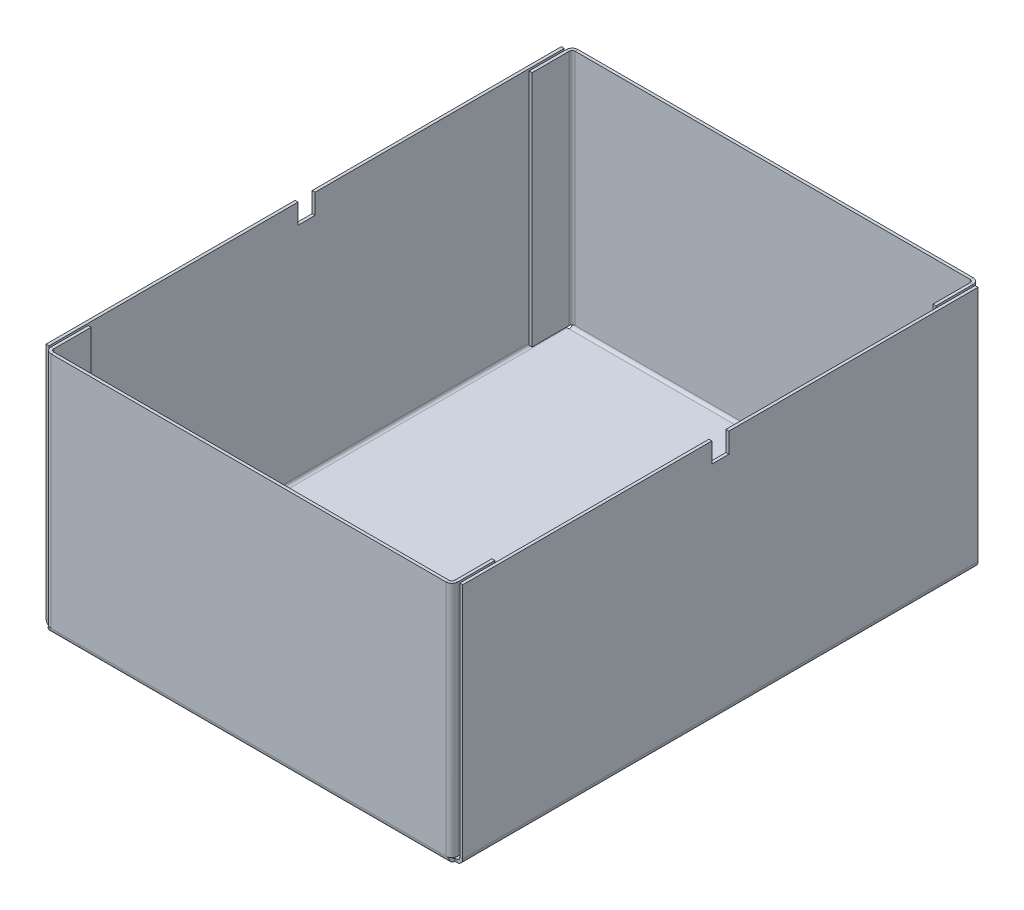
from build123d import *

# Parameters (mm, degrees)
SKETCH1_W                        = 100
SKETCH1_H                        = 130
BASE_FLANGE1_DEPTH               = 0.7366
BOX_REAR_STRIP_W                 = 4.4196
BOX_REAR_STRIP_H                 = 0.7366
BOX_REAR_STRIP_CUT_DEPTH         = 100
BOX_REAR_DEPTH                   = 100
BOX_FRONT_STRIP_W                = 4.4196
BOX_FRONT_STRIP_H                = 0.7366
BOX_FRONT_STRIP_CUT_DEPTH        = 100
BOX_FRONT_DEPTH                  = 100
BOX_FRONT_TABS_STRIP_W           = 4.4196
BOX_FRONT_TABS_STRIP_H           = 0.7366
BOX_FRONT_TABS_STRIP_CUT_DEPTH   = 59.2634
BOX_FRONT_TABS_STRIP_2_W         = 4.4196
BOX_FRONT_TABS_STRIP_2_H         = 0.7366
BOX_FRONT_TABS_STRIP_CUT_2_DEPTH = 59.2634
BOX_FRONT_TABS_DEPTH             = 59.2634
BOX_FRONT_TABS_BEND_DEPTH        = 59.2634
BOX_REAR_TABS_STRIP_W            = 4.4196
BOX_REAR_TABS_STRIP_H            = 0.7366
BOX_REAR_TABS_STRIP_CUT_DEPTH    = 59.2634
BOX_REAR_TABS_STRIP_2_W          = 4.4196
BOX_REAR_TABS_STRIP_2_H          = 0.7366
BOX_REAR_TABS_STRIP_CUT_2_DEPTH  = 59.2634
BOX_REAR_TABS_DEPTH              = 59.2634
BOX_REAR_TABS_BEND_DEPTH         = 59.2634
EDGE_FLANGE6_DEPTH               = 128.5268
EDGE_FLANGE6_START               = 0.7366
EDGE_FLANGE6_FLAT_DEPTH          = 0.7366
EDGE_FLANGE6_BEND_DEPTH          = 128.5268
EDGE_FLANGE6_FLAT_2_DEPTH        = 0.7366


# Sheet-metal steps are written as plain solids
with BuildPart() as part:
    # Sketch1 → Base-Flange1 (new body)
    with BuildSketch(Plane(origin=(0, 0, 0), x_dir=(1, 0, 0), z_dir=(0, 1, 0))):
        Rectangle(SKETCH1_W, SKETCH1_H)
    extrude(amount=-BASE_FLANGE1_DEPTH)

    # Box rear strip (across the edge) → Box rear strip cut (cut)
    with BuildSketch(Plane(origin=(50, 0, -65), x_dir=(0, 0, 1), z_dir=(-1, 0, 0))):
        with Locations((-1.4732, -0.3683)):
            Rectangle(BOX_REAR_STRIP_W, BOX_REAR_STRIP_H)
    extrude(amount=BOX_REAR_STRIP_CUT_DEPTH, mode=Mode.SUBTRACT)

    # Box rear section (across the edge) → Box rear (add)
    with BuildSketch(Plane(origin=(50, 0, -65), x_dir=(0, 0, 1), z_dir=(-1, 0, 0))):
        with BuildLine():
            Line((-0.7366, 0.7366), (-0.7366, 60))
            Line((-0.7366, 60), (0, 60))
            Line((0, 60), (0, 0.7366))
            ThreePointArc((0, 0.7366), (0.215745145, 0.215745145), (0.7366, 0))
            Line((0.7366, 0), (0.7366, -0.7366))
            ThreePointArc((0.7366, -0.7366), (-0.30510971, -0.30510971), (-0.7366, 0.7366))
        make_face()
    extrude(amount=BOX_REAR_DEPTH)

    # Box front strip (across the edge) → Box front strip cut (cut)
    with BuildSketch(Plane(origin=(-50, 0, 65), x_dir=(0, 0, -1), z_dir=(1, 0, 0))):
        with Locations((-1.4732, -0.3683)):
            Rectangle(BOX_FRONT_STRIP_W, BOX_FRONT_STRIP_H)
    extrude(amount=BOX_FRONT_STRIP_CUT_DEPTH, mode=Mode.SUBTRACT)

    # Box front section (across the edge) → Box front (add)
    with BuildSketch(Plane(origin=(-50, 0, 65), x_dir=(0, 0, -1), z_dir=(1, 0, 0))):
        with BuildLine():
            Line((-0.7366, 0.7366), (-0.7366, 60))
            Line((-0.7366, 60), (0, 60))
            Line((0, 60), (0, 0.7366))
            ThreePointArc((0, 0.7366), (0.215745145, 0.215745145), (0.7366, 0))
            Line((0.7366, 0), (0.7366, -0.7366))
            ThreePointArc((0.7366, -0.7366), (-0.30510971, -0.30510971), (-0.7366, 0.7366))
        make_face()
    extrude(amount=BOX_FRONT_DEPTH)

    # Box-front tabs strip (across the edge) → Box-front tabs strip cut (cut)
    with BuildSketch(Plane(origin=(-50, 0.7366, 65), x_dir=(1, 0, 0), z_dir=(0, 1, 0))):
        with Locations((-1.4732, -0.3683)):
            Rectangle(BOX_FRONT_TABS_STRIP_W, BOX_FRONT_TABS_STRIP_H)
    extrude(amount=BOX_FRONT_TABS_STRIP_CUT_DEPTH, mode=Mode.SUBTRACT)

    # Box-front tabs strip 2 (across the edge) → Box-front tabs strip cut 2 (cut)
    with BuildSketch(Plane(origin=(50, 60, 65), x_dir=(-1, 0, 0), z_dir=(0, -1, 0))):
        with Locations((-1.4732, -0.3683)):
            Rectangle(BOX_FRONT_TABS_STRIP_2_W, BOX_FRONT_TABS_STRIP_2_H)
    extrude(amount=BOX_FRONT_TABS_STRIP_CUT_2_DEPTH, mode=Mode.SUBTRACT)

    # Box-front tabs section (across the edge) → Box-front tabs (add)
    with BuildSketch(Plane(origin=(-50, 0.7366, 65), x_dir=(1, 0, 0), z_dir=(0, 1, 0))):
        with BuildLine():
            Line((-0.7366, 0.7366), (-0.7366, 10))
            Line((-0.7366, 10), (0, 10))
            Line((0, 10), (0, 0.7366))
            ThreePointArc((0, 0.7366), (0.215745145, 0.215745145), (0.7366, 0))
            Line((0.7366, 0), (0.7366, -0.7366))
            ThreePointArc((0.7366, -0.7366), (-0.30510971, -0.30510971), (-0.7366, 0.7366))
        make_face()
    extrude(amount=BOX_FRONT_TABS_DEPTH)

    # Box-front tabs section 2 (across the edge) → Box-front tabs bend (add)
    with BuildSketch(Plane(origin=(50, 60, 65), x_dir=(-1, 0, 0), z_dir=(0, -1, 0))):
        with BuildLine():
            Line((-0.7366, 0.7366), (-0.7366, 10))
            Line((-0.7366, 10), (0, 10))
            Line((0, 10), (0, 0.7366))
            ThreePointArc((0, 0.7366), (0.215745145, 0.215745145), (0.7366, 0))
            Line((0.7366, 0), (0.7366, -0.7366))
            ThreePointArc((0.7366, -0.7366), (-0.30510971, -0.30510971), (-0.7366, 0.7366))
        make_face()
    extrude(amount=BOX_FRONT_TABS_BEND_DEPTH)

    # Box-rear tabs strip (across the edge) → Box-rear tabs strip cut (cut)
    with BuildSketch(Plane(origin=(50, 0.7366, -65), x_dir=(-1, 0, 0), z_dir=(0, 1, 0))):
        with Locations((-1.4732, -0.3683)):
            Rectangle(BOX_REAR_TABS_STRIP_W, BOX_REAR_TABS_STRIP_H)
    extrude(amount=BOX_REAR_TABS_STRIP_CUT_DEPTH, mode=Mode.SUBTRACT)

    # Box-rear tabs strip 2 (across the edge) → Box-rear tabs strip cut 2 (cut)
    with BuildSketch(Plane(origin=(-50, 60, -65), x_dir=(1, 0, 0), z_dir=(0, -1, 0))):
        with Locations((-1.4732, -0.3683)):
            Rectangle(BOX_REAR_TABS_STRIP_2_W, BOX_REAR_TABS_STRIP_2_H)
    extrude(amount=BOX_REAR_TABS_STRIP_CUT_2_DEPTH, mode=Mode.SUBTRACT)

    # Box-rear tabs section (across the edge) → Box-rear tabs (add)
    with BuildSketch(Plane(origin=(50, 0.7366, -65), x_dir=(-1, 0, 0), z_dir=(0, 1, 0))):
        with BuildLine():
            Line((-0.7366, 0.7366), (-0.7366, 10))
            Line((-0.7366, 10), (0, 10))
            Line((0, 10), (0, 0.7366))
            ThreePointArc((0, 0.7366), (0.215745145, 0.215745145), (0.7366, 0))
            Line((0.7366, 0), (0.7366, -0.7366))
            ThreePointArc((0.7366, -0.7366), (-0.30510971, -0.30510971), (-0.7366, 0.7366))
        make_face()
    extrude(amount=BOX_REAR_TABS_DEPTH)

    # Box-rear tabs section 2 (across the edge) → Box-rear tabs bend (add)
    with BuildSketch(Plane(origin=(-50, 60, -65), x_dir=(1, 0, 0), z_dir=(0, -1, 0))):
        with BuildLine():
            Line((-0.7366, 0.7366), (-0.7366, 10))
            Line((-0.7366, 10), (0, 10))
            Line((0, 10), (0, 0.7366))
            ThreePointArc((0, 0.7366), (0.215745145, 0.215745145), (0.7366, 0))
            Line((0.7366, 0), (0.7366, -0.7366))
            ThreePointArc((0.7366, -0.7366), (-0.30510971, -0.30510971), (-0.7366, 0.7366))
        make_face()
    extrude(amount=BOX_REAR_TABS_BEND_DEPTH)

    # Edge-Flange6 bend section (across the edge) → Edge-Flange6 (add)
    with BuildSketch(Plane(origin=(-51.2366, 0, -64.2634), x_dir=(1, 0, 0), z_dir=(0, 0, 1))):
        with BuildLine():
            Line((-0.7366, 0.7366), (0, 0.7366))
            ThreePointArc((0, 0.7366), (0.215745145, 0.215745145), (0.7366, 0))
            Line((0.7366, 0), (1.2366, 0))
            Line((1.2366, 0), (1.2366, -0.7366))
            Line((1.2366, -0.7366), (0.7366, -0.7366))
            ThreePointArc((0.7366, -0.7366), (-0.30510971, -0.30510971), (-0.7366, 0.7366))
        make_face()
    extrude(amount=EDGE_FLANGE6_DEPTH)

    # Edge-Flange6 profile (on flange) → Edge-Flange6 flat (add)
    with BuildSketch(Plane.ZY.offset(51.2366).offset(EDGE_FLANGE6_START)):
        Polygon((-64.2634, 60), (-64.2634, 0.7366), (64.2634, 0.7366), (64.2634, 60), (2.12, 60), (2.12, 55), (-2.12, 55), (-2.12, 60), align=None)
    extrude(amount=-EDGE_FLANGE6_FLAT_DEPTH)

    # Edge-Flange6 bend section 2 (across the edge) → Edge-Flange6 bend (add)
    with BuildSketch(Plane(origin=(51.2366, 0, 64.2634), x_dir=(-1, 0, 0), z_dir=(0, 0, -1))):
        with BuildLine():
            Line((-0.7366, 0.7366), (0, 0.7366))
            ThreePointArc((0, 0.7366), (0.215745145, 0.215745145), (0.7366, 0))
            Line((0.7366, 0), (1.2366, 0))
            Line((1.2366, 0), (1.2366, -0.7366))
            Line((1.2366, -0.7366), (0.7366, -0.7366))
            ThreePointArc((0.7366, -0.7366), (-0.30510971, -0.30510971), (-0.7366, 0.7366))
        make_face()
    extrude(amount=EDGE_FLANGE6_BEND_DEPTH)

    # Edge-Flange6 profile 2 (on flange) → Edge-Flange6 flat 2 (add)
    with BuildSketch(Plane(origin=(51.2366, 0, 0), x_dir=(0, 0, -1), z_dir=(1, 0, 0)).offset(EDGE_FLANGE6_START)):
        Polygon((-64.2634, 60), (-64.2634, 0.7366), (64.2634, 0.7366), (64.2634, 60), (2.12, 60), (2.12, 55), (-2.12, 55), (-2.12, 60), align=None)
    extrude(amount=-EDGE_FLANGE6_FLAT_2_DEPTH)


solid = part.part
